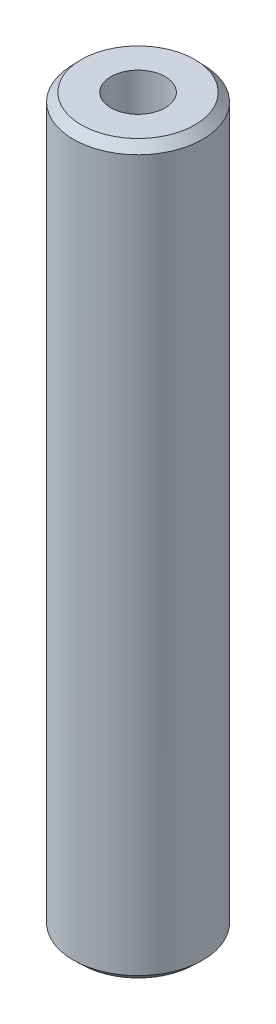
from build123d import *
from OCP.BRepFilletAPI import BRepFilletAPI_MakeChamfer

# Parameters (mm, degrees)
SKETCH1_R           = 10
BOSS_EXTRUDE1_DEPTH = 112.385703905
SKETCH2_R           = 4.189506138
CUT_EXTRUDE1_DEPTH  = 114.272002023
CHAMFER1_SIZE       = 1.30319021
CHAMFER1_SIZE2      = 1.237035523


with BuildPart() as part:
    # Sketch1 → Boss-Extrude1 (new body)
    with BuildSketch(Plane(origin=(0, 0, 0), x_dir=(1, 0, 0), z_dir=(0, 1, 0))):
        Circle(SKETCH1_R)
    extrude(amount=BOSS_EXTRUDE1_DEPTH)

    # Sketch2 → Cut-Extrude1 (cut, through all)
    with BuildSketch(Plane(origin=(0, 0, 0), x_dir=(1, 0, 0), z_dir=(0, 1, 0))):
        Circle(SKETCH2_R)
    extrude(amount=CUT_EXTRUDE1_DEPTH, mode=Mode.SUBTRACT)

    # Chamfer1: one chamfer whose edges measure the first distance from different faces: ONE call of the kernel's chamfer builder (chamfer() names one face for all edges)
    chamfer1_edges_1 = [part.edges().sort_by_distance(p)[0] for p in [
        (-10, 112.385703905, 0),
    ]]
    chamfer1_side_1 = [part.faces().sort_by_distance(p)[0] for p in [
        (-10, 56.192851952, 0),
    ]]
    chamfer1_edges_2 = [part.edges().sort_by_distance(p)[0] for p in [
        (-10, 0, 0),
    ]]
    chamfer1_side_2 = [part.faces().sort_by_distance(p)[0] for p in [
        (-9.717157288, 0, 0),
    ]]
    chamfer1 = BRepFilletAPI_MakeChamfer(part.part.solid().wrapped)
    for e in chamfer1_edges_1:
        chamfer1.Add(CHAMFER1_SIZE, CHAMFER1_SIZE2, e.wrapped, chamfer1_side_1[0].wrapped)  # the first distance lies on this face
    for e in chamfer1_edges_2:
        chamfer1.Add(CHAMFER1_SIZE, CHAMFER1_SIZE2, e.wrapped, chamfer1_side_2[0].wrapped)  # the first distance lies on this face
    add(Compound.cast(chamfer1.Shape()), mode=Mode.REPLACE)


solid = part.part
